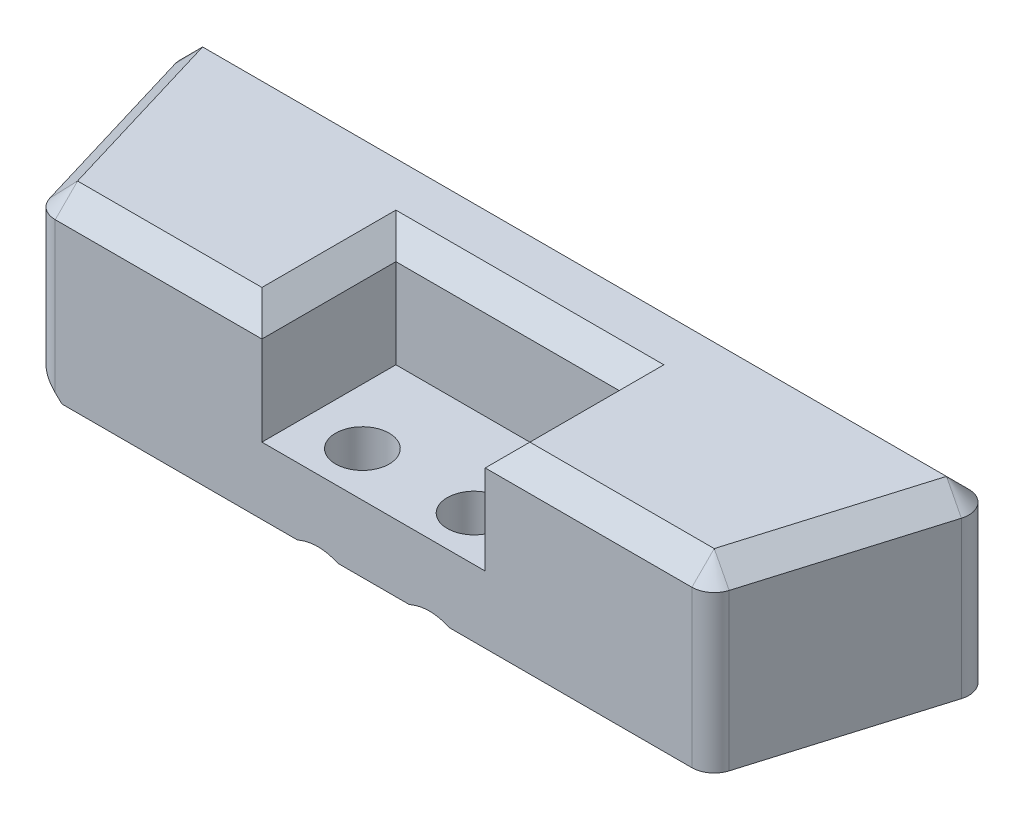
from build123d import *

# Parameters (mm, degrees)
RESSALTO_EXTRUS_O2_DEPTH                             = 8
ESBO_O5_W                                            = 10
ESBO_O5_H                                            = 6
CORTE_EXTRUS_O1_DEPTH                                = 5
ESCAREADO_PARA_PARAFUSO_COM_CABE_A_ESCAR_D           = 2.4
ESCAREADO_PARA_PARAFUSO_COM_CABE_A_ESCAR_CSINK_D     = 4.4
ESCAREADO_PARA_PARAFUSO_COM_CABE_A_ESCAR_CSINK_ANGLE = 90
CHANFRO1_SIZE                                        = 1


with BuildPart() as part:
    # Esboço2 → Ressalto-extrusão2 (new body)
    with BuildSketch(Plane(origin=(0, 0, 0), x_dir=(1, 0, 0), z_dir=(0, 1, 0))):
        with BuildLine():
            Line((-0.213795634, 0.712652114), (-2.613795634, 8.712652114))
            ThreePointArc((-2.613795634, 8.712652114), (-2.458262277, 9.59693053), (-1.655969349, 10))
            Line((-1.655969349, 10), (31.655969349, 10))
            ThreePointArc((31.655969349, 10), (32.458262277, 9.59693053), (32.613795634, 8.712652114))
            Line((32.613795634, 8.712652114), (30.213795634, 0.712652114))
            ThreePointArc((30.213795634, 0.712652114), (29.852899879, 0.197707072), (29.255969349, 0))
            Line((29.255969349, 0), (0.744030651, 0))
            ThreePointArc((0.744030651, 0), (0.147100121, 0.197707072), (-0.213795634, 0.712652114))
        make_face()
    extrude(amount=RESSALTO_EXTRUS_O2_DEPTH)

    # Esboço5 → Corte-extrusão1 (cut)
    with BuildSketch(Plane(origin=(0, 8, 0), x_dir=(1, 0, 0), z_dir=(0, 1, 0))):
        with Locations((15, 3)):
            Rectangle(ESBO_O5_W, ESBO_O5_H)
    extrude(amount=-CORTE_EXTRUS_O1_DEPTH, mode=Mode.SUBTRACT)

    # Escareado para parafuso com cabeça escareada chata de M21 (through all)
    with Locations(Plane(origin=(17.5, 0, -2), x_dir=(0, 0, -1), z_dir=(0, -1, 0))):
        with Locations((0, 0), (0, -5)):
            CounterSinkHole(ESCAREADO_PARA_PARAFUSO_COM_CABE_A_ESCAR_D / 2, ESCAREADO_PARA_PARAFUSO_COM_CABE_A_ESCAR_CSINK_D / 2, counter_sink_angle=ESCAREADO_PARA_PARAFUSO_COM_CABE_A_ESCAR_CSINK_ANGLE)

    # Chanfro1
    # the kernel refuses this chamfer: 1 mm, written as the material it takes off along each edge
    with BuildSketch(Plane(origin=(10, 8, -6), x_dir=(0, 0, -1), z_dir=(1, 0, 0))) as chanfro1_piece_1:
        Polygon((CHANFRO1_SIZE, 0), (0, -CHANFRO1_SIZE), (0, 0), align=None)
    extrude(amount=10, mode=Mode.SUBTRACT)
    with BuildSketch(Plane(origin=(10, 8, 2.571682988), x_dir=(-1, 0, 0), z_dir=(0, 0, -1)), Plane(origin=(20, 8, -6), x_dir=(1, 0, 0), z_dir=(0, 0, 1))) as chanfro1_piece_2:
        Polygon((CHANFRO1_SIZE, 0), (0, -CHANFRO1_SIZE), (0, 0), align=None)
    extrude(amount=8.571682988, mode=Mode.SUBTRACT)
    with BuildSketch(Plane(origin=(12.571682988, 8, 0), x_dir=(0, 0, -1), z_dir=(-1, 0, 0)), Plane(origin=(29.255969349, 8, 0), x_dir=(0, 0, -1), z_dir=(-1, 0, 0))) as chanfro1_piece_3:
        Polygon((CHANFRO1_SIZE, 0), (0, CHANFRO1_SIZE), (0, 0), align=None)
    extrude(amount=11.827652337, mode=Mode.SUBTRACT)
    with BuildSketch(Plane(origin=(0.744030651, 8, -1), x_dir=(0, 0, 1), z_dir=(1, 0, 0))) as chanfro1_piece_4:
        Polygon((1 - CHANFRO1_SIZE, 0), (1, CHANFRO1_SIZE), (1, 0), align=None)
    revolve(axis=Axis((0.744030651, 8, -1), (0, -1, 0)), revolution_arc=73.300755766, mode=Mode.SUBTRACT)
    with BuildSketch(Plane(origin=(-0.213795634, 8, -0.712652114), x_dir=(0, -1, 0), z_dir=(-0.28734788556634544, 0, -0.9578262852211514))) as chanfro1_piece_5:
        Polygon((CHANFRO1_SIZE, 0), (0, -CHANFRO1_SIZE), (0, 0), align=None)
    extrude(amount=8.352245207, mode=Mode.SUBTRACT)
    with BuildSketch(Plane(origin=(-1.655969349, 8, -9), x_dir=(-0.957826285221151, 0, 0.2873478855663471), z_dir=(0.2873478855663471, 0, 0.957826285221151))) as chanfro1_piece_6:
        Polygon((1 - CHANFRO1_SIZE, 0), (1, CHANFRO1_SIZE), (1, 0), align=None)
    revolve(axis=Axis((-1.655969349, 8, -9), (0, -1, 0)), revolution_arc=106.699244234, mode=Mode.SUBTRACT)
    with BuildSketch(Plane(origin=(-1.655969349, 8, -10), x_dir=(0, 0, 1), z_dir=(1, 0, 0))) as chanfro1_piece_7:
        Polygon((CHANFRO1_SIZE, 0), (0, CHANFRO1_SIZE), (0, 0), align=None)
    extrude(amount=33.311938698, mode=Mode.SUBTRACT)
    with BuildSketch(Plane(origin=(31.655969349, 8, -9), x_dir=(0, 0, -1), z_dir=(-1, 0, 0))) as chanfro1_piece_8:
        Polygon((1 - CHANFRO1_SIZE, 0), (1, CHANFRO1_SIZE), (1, 0), align=None)
    revolve(axis=Axis((31.655969349, 8, -9), (0, -1, 0)), revolution_arc=106.699244234, mode=Mode.SUBTRACT)
    with BuildSketch(Plane(origin=(32.613795634, 8, -8.712652114), x_dir=(-0.9578262852211513, 0, -0.2873478855663455), z_dir=(-0.28734788556634555, 0, 0.9578262852211514))) as chanfro1_piece_9:
        Polygon((CHANFRO1_SIZE, 0), (0, CHANFRO1_SIZE), (0, 0), align=None)
    extrude(amount=8.352245207, mode=Mode.SUBTRACT)
    with BuildSketch(Plane(origin=(29.255969349, 8, -1), x_dir=(0.9578262852211534, 0, 0.2873478855663385), z_dir=(0.2873478855663385, 0, -0.9578262852211534))) as chanfro1_piece_10:
        Polygon((1 - CHANFRO1_SIZE, 0), (1, CHANFRO1_SIZE), (1, 0), align=None)
    revolve(axis=Axis((29.255969349, 8, -1), (0, -1, 0)), revolution_arc=73.300755766, mode=Mode.SUBTRACT)
    with BuildSketch(Plane(origin=(0.525172035, 0, 1.750573449), x_dir=(0, 1, 0), z_dir=(-0.28734788556634544, 0, -0.9578262852211514))) as chanfro1_piece_11:
        Polygon((CHANFRO1_SIZE, 0), (0, CHANFRO1_SIZE), (0, 0), align=None)
    extrude(amount=13.495611183, mode=Mode.SUBTRACT)
    with BuildSketch(Plane(origin=(10, 8, 0), x_dir=(-1, 0, 0), z_dir=(0, 0, -1))) as chanfro1_piece_12a_section:
        Polygon((CHANFRO1_SIZE, 0), (0, -CHANFRO1_SIZE), (0, 0), align=None)
    chanfro1_piece_12a = extrude(amount=8.571682988, mode=Mode.PRIVATE)
    chanfro1_piece_12a = split(chanfro1_piece_12a, bisect_by=Plane(origin=(10, 8, -6), z_dir=(0, 0, -1)), keep=Keep.TOP, mode=Mode.PRIVATE)
    with BuildSketch(Plane(origin=(7.428317012, 8, -6), x_dir=(0, 0, -1), z_dir=(1, 0, 0))) as chanfro1_piece_12b_section:
        Polygon((CHANFRO1_SIZE, 0), (0, -CHANFRO1_SIZE), (0, 0), align=None)
    chanfro1_piece_12b = extrude(amount=12.571682988, mode=Mode.PRIVATE)
    chanfro1_piece_12b = split(chanfro1_piece_12b, bisect_by=Plane(origin=(10, 8, -6), z_dir=(-1, 0, 0)), keep=Keep.TOP, mode=Mode.PRIVATE)
    chanfro1_piece_12 = chanfro1_piece_12a & chanfro1_piece_12b
    add(chanfro1_piece_12, mode=Mode.SUBTRACT)
    with BuildSketch(Plane(origin=(10, 8, -6), x_dir=(0, 0, -1), z_dir=(1, 0, 0))) as chanfro1_piece_13a_section:
        Polygon((CHANFRO1_SIZE, 0), (0, -CHANFRO1_SIZE), (0, 0), align=None)
    chanfro1_piece_13a = extrude(amount=12.571682988, mode=Mode.PRIVATE)
    chanfro1_piece_13a = split(chanfro1_piece_13a, bisect_by=Plane(origin=(20, 8, -6), z_dir=(1, 0, 0)), keep=Keep.TOP, mode=Mode.PRIVATE)
    with BuildSketch(Plane(origin=(20, 8, -8.571682988), x_dir=(1, 0, 0), z_dir=(0, 0, 1))) as chanfro1_piece_13b_section:
        Polygon((CHANFRO1_SIZE, 0), (0, -CHANFRO1_SIZE), (0, 0), align=None)
    chanfro1_piece_13b = extrude(amount=8.571682988, mode=Mode.PRIVATE)
    chanfro1_piece_13b = split(chanfro1_piece_13b, bisect_by=Plane(origin=(20, 8, -6), z_dir=(0, 0, -1)), keep=Keep.TOP, mode=Mode.PRIVATE)
    chanfro1_piece_13 = chanfro1_piece_13a & chanfro1_piece_13b
    add(chanfro1_piece_13, mode=Mode.SUBTRACT)


solid = part.part
